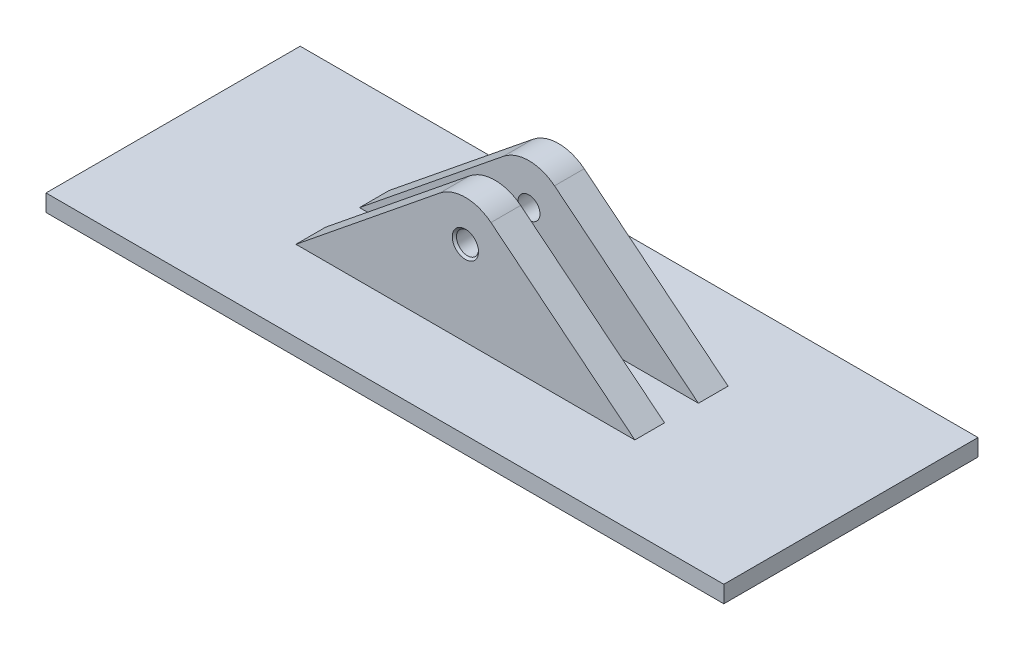
from build123d import *

# Parameters (mm, degrees)
SKETCH1_R           = 2.6
BOSS_EXTRUDE1_DEPTH = 22
SKETCH2_W           = 160
SKETCH2_H           = 60
BOSS_EXTRUDE2_DEPTH = 4
SKETCH3_W           = 8
SKETCH3_H           = 35
CUT_EXTRUDE1_DEPTH  = 167.904164118
CHAMFER1_SIZE       = 0.5


with BuildPart() as part:
    # Sketch1 → Boss-Extrude1 (new body)
    with BuildSketch(Plane.XY):
        with BuildLine():
            Line((-6.036367471, 7.464734942), (-40, -20))
            Line((-40, -20), (40, -20))
            Line((40, -20), (6.036367471, 7.464734942))
            ThreePointArc((6.036367471, 7.464734942), (0, 9.6), (-6.036367471, 7.464734942))
        make_face()
        Circle(SKETCH1_R, mode=Mode.SUBTRACT)
    extrude(amount=BOSS_EXTRUDE1_DEPTH)

    # Sketch2 → Boss-Extrude2 (add)
    with BuildSketch(Plane(origin=(0, -20, 0), x_dir=(-1, 0, 0), z_dir=(0, -1, 0))):
        with Locations((0, -11)):
            Rectangle(SKETCH2_W, SKETCH2_H)
    extrude(amount=BOSS_EXTRUDE2_DEPTH)

    # Sketch3 → Cut-Extrude1 (cut, through all)
    with BuildSketch(Plane(origin=(80, 0, 0), x_dir=(0, 0, -1), z_dir=(1, 0, 0))):
        with Locations((-11, -2.5)):
            Rectangle(SKETCH3_W, SKETCH3_H)
    extrude(amount=-CUT_EXTRUDE1_DEPTH, mode=Mode.SUBTRACT)

    # Chamfer1
    chamfer1_edges = [part.edges().sort_by_distance(p)[0] for p in [
        (-2.6, 0, 22),
        (-2.6, 0, 0),
    ]]
    chamfer(chamfer1_edges, length=CHAMFER1_SIZE)


solid = part.part
